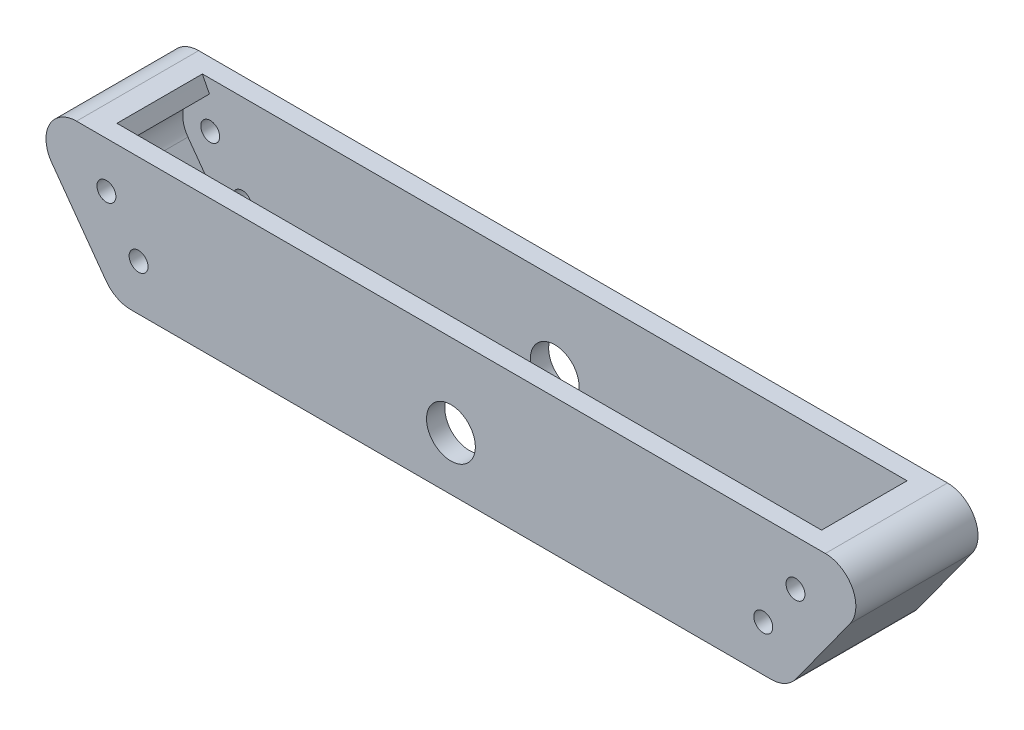
from build123d import *

# Parameters (mm, degrees)
BOSS_EXTRUDE1_DEPTH   = 7
BOSS_EXTRUDE1_2_DEPTH = 7
SKETCH2_R             = 4
SKETCH2_R_2           = 1.55
BOSS_EXTRUDE2_DEPTH   = 3
FILLET1_R             = 5
FILLET2_R             = 1


with BuildPart() as part:
    # Sketch1 → Boss-Extrude1 (new, symmetric)
    with BuildSketch(Plane.XY):
        with BuildLine():
            Line((-57.692807239, -27.704512139), (-71.0874428, -27.704512139))
            Line((-71.0874428, -27.704512139), (-54.981120944, -50))
            Line((-54.981120944, -50), (-39.949968711, -50))
            ThreePointArc((-39.949968711, -50), (-43.032344249, -47.373171188), (-45.942408988, -44.556649968))
            Line((-45.942408988, -44.556649968), (-48.76458719, -46.317700387))
            ThreePointArc((-48.76458719, -46.317700387), (-52.012858014, -46.915883336), (-54.794591341, -45.135140265))
            Line((-54.794591341, -45.135140265), (-60.064871871, -37.839652404))
            ThreePointArc((-60.064871871, -37.839652404), (-60.833011276, -34.338501535), (-58.79938816, -31.386811752))
            Line((-58.79938816, -31.386811752), (-56.544061175, -29.979478746))
            ThreePointArc((-56.544061175, -29.979478746), (-57.129759272, -28.847714043), (-57.692807239, -27.704512139))
        make_face()
    extrude(amount=BOSS_EXTRUDE1_DEPTH, both=True)



with BuildPart() as body_2:
    # Sketch1 → Boss-Extrude1 2 (new, symmetric)
    with BuildSketch(Plane.XY):
        with BuildLine():
            Line((39.949968711, -50), (54.981120944, -50))
            Line((54.981120944, -50), (71.0874428, -27.704512139))
            Line((71.0874428, -27.704512139), (57.692807239, -27.704512139))
            ThreePointArc((57.692807239, -27.704512139), (57.129759272, -28.847714043), (56.544061175, -29.979478746))
            Line((56.544061175, -29.979478746), (58.79938816, -31.386811752))
            ThreePointArc((58.79938816, -31.386811752), (60.833011276, -34.338501535), (60.064871871, -37.839652404))
            Line((60.064871871, -37.839652404), (54.794591341, -45.135140265))
            ThreePointArc((54.794591341, -45.135140265), (52.012858014, -46.915883336), (48.76458719, -46.317700387))
            Line((48.76458719, -46.317700387), (45.942408988, -44.556649968))
            ThreePointArc((45.942408988, -44.556649968), (43.032344249, -47.373171188), (39.949968711, -50))
        make_face()
    extrude(amount=BOSS_EXTRUDE1_2_DEPTH, both=True)


with BuildPart() as part_1:
    add(part.part)

    add(body_2.part)  # Boss-Extrude2 merges body 2
    # Sketch2 → Boss-Extrude2 (add)
    with BuildSketch(Plane.XY.offset(7)):
        Polygon((-54.981120944, -50), (54.981120944, -50), (71.0874428, -27.704512139), (-71.0874428, -27.704512139), align=None)
        with Locations((0, -41.25)):
            Circle(SKETCH2_R, mode=Mode.SUBTRACT)
        with Locations((-51.14684741, -42.5)):
            Circle(SKETCH2_R_2, mode=Mode.SUBTRACT)
        with Locations((-56.417127941, -35.204512139)):
            Circle(SKETCH2_R_2, mode=Mode.SUBTRACT)
        with Locations((56.417127941, -35.204512139)):
            Circle(SKETCH2_R_2, mode=Mode.SUBTRACT)
        with Locations((51.14684741, -42.5)):
            Circle(SKETCH2_R_2, mode=Mode.SUBTRACT)
    boss_extrude2 = extrude(amount=BOSS_EXTRUDE2_DEPTH)

    # Mirror2: Boss-Extrude2 across plane
    add(boss_extrude2.mirror(Plane.XY))

    # Fillet1
    fillet1_edges = [part_1.edges().sort_by_distance(p)[0] for p in [
        (-54.981120944, -50, 0),
        (54.981120944, -50, 0),
        (71.0874428, -27.704512139, 0),
        (-71.0874428, -27.704512139, 0),
    ]]
    fillet(fillet1_edges, radius=FILLET1_R)

    # Fillet2
    fillet2_edges = [part_1.edges().sort_by_distance(p)[0] for p in [
        (39.949968711, -50, 0),
        (-39.949968711, -50, 0),
    ]]
    fillet(fillet2_edges, radius=FILLET2_R)


solid = part_1.part
